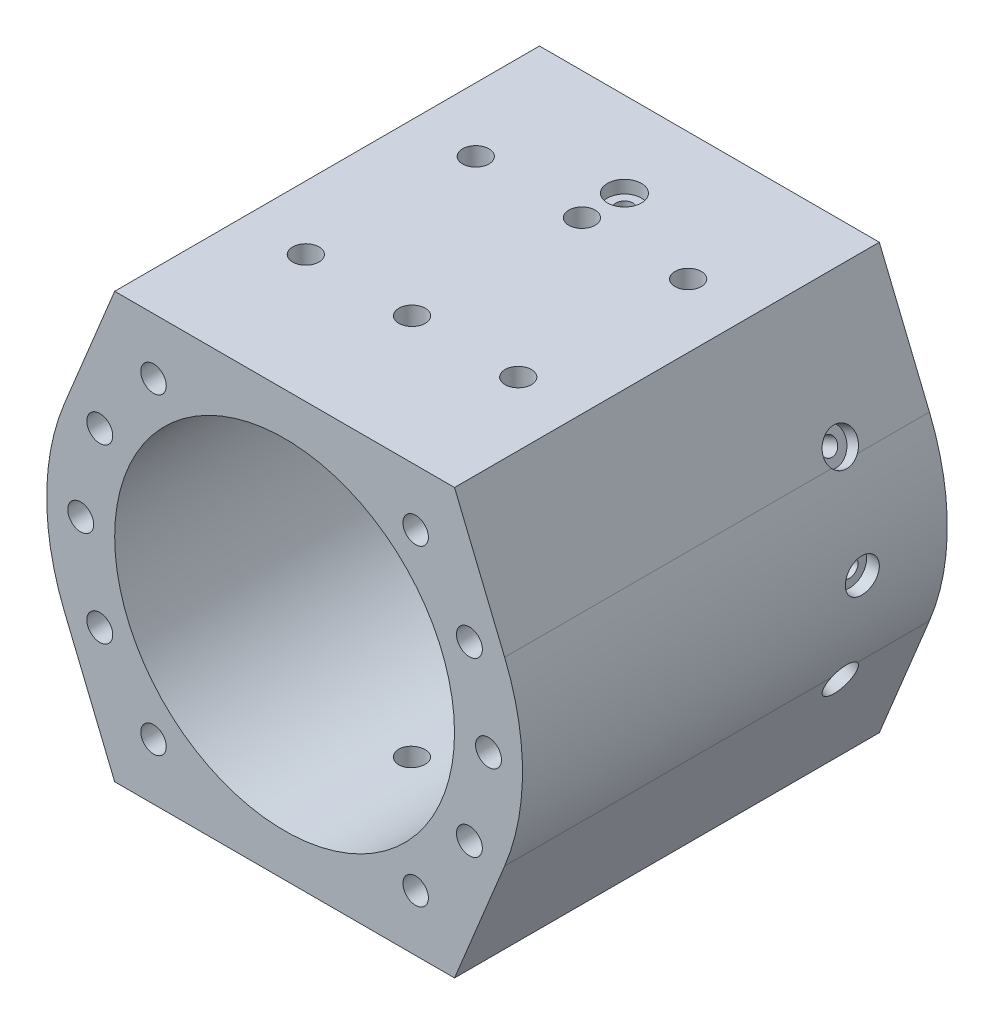
from build123d import *

# Parameters (mm, degrees)
SKETCH_1_R                       = 40
EXTRUDE_1_DEPTH                  = 100
SKETCH_2_R                       = 3.05
CUT_EXTRUDE_1_DEPTH              = 8
SKETCH_3_R                       = 3
CUT_EXTRUDE_2_DEPTH              = 100
CUT_EXTRUDE_3_REACH              = 160.253
SKETCH_4_R                       = 2
CUT_EXTRUDE_3_DIRECTION_2_DEPTH  = 3
SKETCH_5_R                       = 4
CUT_EXTRUDE_4_DEPTH              = 3
PATTERN_START                    = 39.94996861
PATTERN_CIRCULAR_1_OUTLINE_R     = 2
PATTERN_CIRCULAR_1_DEPTH         = 16.296886398
PATTERN_START_2                  = 53
PATTERN_CIRCULAR_1_2_OUTLINE_R   = 4
PATTERN_CIRCULAR_1_2_OUTLINE_R_2 = 2
PATTERN_CIRCULAR_1_2_DEPTH       = 3.246855008
PATTERN_CIRCULAR_1_3_OUTLINE_R   = 2
PATTERN_CIRCULAR_1_3_DEPTH       = 16.296886398
PATTERN_CIRCULAR_1_4_OUTLINE_R   = 4
PATTERN_CIRCULAR_1_4_OUTLINE_R_2 = 2
PATTERN_CIRCULAR_1_4_DEPTH       = 3.246855008
SKETCH_7_R                       = 2
CUT_EXTRUDE_5_DEPTH              = 153.105226841
SKETCH_8_R                       = 4
CUT_EXTRUDE_6_DEPTH              = 3
CUT_EXTRUDE_START                = -3
SKETCH_9_R                       = 4
CUT_EXTRUDE_7_DEPTH              = 3
SKETCH_10_R                      = 3.1
CUT_EXTRUDE_8_DEPTH              = 8
SKETCH_11_R                      = 3.1
CUT_EXTRUDE_9_DEPTH              = 100


# Read off the part's stored shape, not the designer's step: Круговой массив1
with BuildPart() as part:
    # Эскиз1 → Бобышка-Вытянуть1 (new body)
    with BuildSketch(Plane.XY):
        with BuildLine():
            Line((40, 50), (-40, 50))
            Line((-40, 50), (-51.798872756, 21.280901795))
            ThreePointArc((-51.798872756, 21.280901795), (-56, 0), (-51.798872756, -21.280901795))
            Line((-51.798872756, -21.280901795), (-40, -50))
            Line((-40, -50), (40, -50))
            Line((40, -50), (51.798872756, -21.280901795))
            ThreePointArc((51.798872756, -21.280901795), (56, 0), (51.798872756, 21.280901795))
            Line((51.798872756, 21.280901795), (40, 50))
        make_face()
        Circle(SKETCH_1_R, mode=Mode.SUBTRACT)
    extrude(amount=EXTRUDE_1_DEPTH)

    # Эскиз2 → Вырез-Вытянуть1 (cut)
    with BuildSketch(Plane.XY.offset(100)):
        with Locations((-48, 0)):
            Circle(SKETCH_2_R)
        with Locations((-43.502773778, 20.285676564)):
            Circle(SKETCH_2_R)
        with Locations((-43.502773778, -20.285676564)):
            Circle(SKETCH_2_R)
        with Locations(Location((43.502773778, -20.285676564, 0), (0, 0, 180))):
            Circle(SKETCH_2_R)
        with Locations(Location((43.502773778, 20.285676564, 0), (0, 0, 180))):
            Circle(SKETCH_2_R)
        with Locations(Location((48, 0, 0), (0, 0, 180))):
            Circle(SKETCH_2_R)
    cut_extrude_1 = extrude(amount=-CUT_EXTRUDE_1_DEPTH, mode=Mode.SUBTRACT)

    # Зеркальное отражение1: Вырез-Вытянуть1 across plane
    add(cut_extrude_1.mirror(Plane.XY.offset(50)), mode=Mode.SUBTRACT)

    # Эскиз3 → Вырез-Вытянуть2 (cut)
    with BuildSketch(Plane.XY.offset(100)):
        with Locations((-30.853805265, 36.77013327)):
            Circle(SKETCH_3_R)
        with Locations((-30.853805265, -36.77013327)):
            Circle(SKETCH_3_R)
        with Locations((30.853805265, -36.77013327)):
            Circle(SKETCH_3_R)
        with Locations((30.853805265, 36.77013327)):
            Circle(SKETCH_3_R)
    extrude(amount=-CUT_EXTRUDE_2_DEPTH, mode=Mode.SUBTRACT)

    # Эскиз4 → Вырез-Вытянуть3 (cut, up to next)
    with BuildSketch(Plane(origin=(56, 0, 0), x_dir=(0, 0, -1), z_dir=(1, 0, 0)), mode=Mode.PRIVATE) as cut_extrude_3_sk1:
        with Locations(Location((-20, 0, 0), (0, 0, 180))):
            Circle(SKETCH_4_R)
    cut_extrude_3_tool1 = extrude(cut_extrude_3_sk1.sketch, amount=-CUT_EXTRUDE_3_REACH, mode=Mode.PRIVATE) & part.part
    cut_extrude_3 = cut_extrude_3_tool1.solids().sort_by_distance((56, 0, 20))[0]
    add(cut_extrude_3, mode=Mode.SUBTRACT)

    # Эскиз4 → Вырез-Вытянуть3 direction 2 (cut)
    with BuildSketch(Plane(origin=(56, 0, 0), x_dir=(0, 0, -1), z_dir=(1, 0, 0))):
        with Locations(Location((-20, 0, 0), (0, 0, 180))):
            Circle(SKETCH_4_R)
    cut_extrude_3_direction_2 = extrude(amount=CUT_EXTRUDE_3_DIRECTION_2_DEPTH, mode=Mode.SUBTRACT)

    # Эскиз5 → Вырез-Вытянуть4 (cut, symmetric)
    with BuildSketch(Plane(origin=(56, 0, 0), x_dir=(0, 0, -1), z_dir=(1, 0, 0))):
        with Locations(Location((-20, 0, 0), (0, 0, 180))):
            Circle(SKETCH_5_R)
    cut_extrude_4 = extrude(amount=CUT_EXTRUDE_4_DEPTH, both=True, mode=Mode.SUBTRACT)

    # Круговой массив1 outline → Круговой массив1 (cut)
    with BuildSketch(Plane(origin=(0, 0, 0), x_dir=(-0.4226182617407003, 0.9063077870366495, 0), z_dir=(0.9063077870366496, 0.4226182617407003, 0)).offset(PATTERN_START)):
        with Locations((0, 20)):
            Circle(PATTERN_CIRCULAR_1_OUTLINE_R)
    pattern_circular_1 = extrude(amount=PATTERN_CIRCULAR_1_DEPTH, mode=Mode.SUBTRACT)

    # Pattern Circular 1 2 outline → Pattern Circular 1 2 (cut)
    with BuildSketch(Plane(origin=(0, 0, 0), x_dir=(-0.4226182617407003, 0.9063077870366495, 0), z_dir=(0.9063077870366496, 0.4226182617407003, 0)).offset(PATTERN_START_2)):
        with Locations((0, 20)):
            Circle(PATTERN_CIRCULAR_1_2_OUTLINE_R)
        with Locations((0, 20)):
            Circle(PATTERN_CIRCULAR_1_2_OUTLINE_R_2, mode=Mode.SUBTRACT)
    pattern_circular_1_2 = extrude(amount=PATTERN_CIRCULAR_1_2_DEPTH, mode=Mode.SUBTRACT)

    # Pattern Circular 1 3 outline → Pattern Circular 1 3 (cut)
    with BuildSketch(Plane(origin=(0, 0, 0), x_dir=(0.4226182617407003, 0.9063077870366495, 0), z_dir=(0.9063077870366496, -0.4226182617407003, 0)).offset(PATTERN_START)):
        with Locations((0, 20)):
            Circle(PATTERN_CIRCULAR_1_3_OUTLINE_R)
    pattern_circular_1_3 = extrude(amount=PATTERN_CIRCULAR_1_3_DEPTH, mode=Mode.SUBTRACT)

    # Pattern Circular 1 4 outline → Pattern Circular 1 4 (cut)
    with BuildSketch(Plane(origin=(0, 0, 0), x_dir=(0.4226182617407003, 0.9063077870366495, 0), z_dir=(0.9063077870366496, -0.4226182617407003, 0)).offset(PATTERN_START_2)):
        with Locations((0, 20)):
            Circle(PATTERN_CIRCULAR_1_4_OUTLINE_R)
        with Locations((0, 20)):
            Circle(PATTERN_CIRCULAR_1_4_OUTLINE_R_2, mode=Mode.SUBTRACT)
    pattern_circular_1_4 = extrude(amount=PATTERN_CIRCULAR_1_4_DEPTH, mode=Mode.SUBTRACT)

    # Зеркальное отражение2: Вырез-Вытянуть3, Вырез-Вытянуть3 direction 2, Вырез-Вытянуть4, Круговой массив1, Pattern Circular 1 2, Pattern Circular 1 3, Pattern Circular 1 4 across plane
    add(cut_extrude_3.mirror(Plane.ZY), mode=Mode.SUBTRACT)
    add(cut_extrude_3_direction_2.mirror(Plane.ZY), mode=Mode.SUBTRACT)
    add(cut_extrude_4.mirror(Plane.ZY), mode=Mode.SUBTRACT)
    add(pattern_circular_1.mirror(Plane.ZY), mode=Mode.SUBTRACT)
    add(pattern_circular_1_2.mirror(Plane.ZY), mode=Mode.SUBTRACT)
    add(pattern_circular_1_3.mirror(Plane.ZY), mode=Mode.SUBTRACT)
    add(pattern_circular_1_4.mirror(Plane.ZY), mode=Mode.SUBTRACT)

    # Эскиз7 → Вырез-Вытянуть5 (cut, through all)
    with BuildSketch(Plane(origin=(0, 50, 0), x_dir=(1, 0, 0), z_dir=(0, 1, 0))):
        with Locations(Location((0, -20, 0), (0, 0, 180))):
            Circle(SKETCH_7_R)
    extrude(amount=-CUT_EXTRUDE_5_DEPTH, mode=Mode.SUBTRACT)

    # Эскиз8 → Вырез-Вытянуть6 (cut)
    with BuildSketch(Plane(origin=(0, 50, 0), x_dir=(1, 0, 0), z_dir=(0, 1, 0))):
        with Locations(Location((0, -20, 0), (0, 0, 180))):
            Circle(SKETCH_8_R)
    extrude(amount=-CUT_EXTRUDE_6_DEPTH, mode=Mode.SUBTRACT)

    # Эскиз9 → Вырез-Вытянуть7 (cut)
    with BuildSketch(Plane.XZ.offset(50).offset(CUT_EXTRUDE_START)):
        with Locations(Location((0, 20, 0), (0, 0, 180))):
            Circle(SKETCH_9_R)
    extrude(amount=CUT_EXTRUDE_7_DEPTH, mode=Mode.SUBTRACT)

    # Эскиз10 → Вырез-Вытянуть8 (cut)
    with BuildSketch(Plane(origin=(0, 50, 0), x_dir=(1, 0, 0), z_dir=(0, 1, 0))):
        with Locations(Location((-25, -30, 0), (0, 0, 180))):
            Circle(SKETCH_10_R)
        with Locations(Location((0, -30, 0), (0, 0, 180))):
            Circle(SKETCH_10_R)
        with Locations(Location((25, -30, 0), (0, 0, 180))):
            Circle(SKETCH_10_R)
        with Locations((25, -70)):
            Circle(SKETCH_10_R)
        with Locations((0, -70)):
            Circle(SKETCH_10_R)
        with Locations((-25, -70)):
            Circle(SKETCH_10_R)
    cut_extrude_8 = extrude(amount=-CUT_EXTRUDE_8_DEPTH, mode=Mode.SUBTRACT)

    # Зеркальное отражение3: Вырез-Вытянуть8 across plane
    add(cut_extrude_8.mirror(Plane.ZX), mode=Mode.SUBTRACT)

    # Эскиз11 → Вырез-Вытянуть9 (cut)
    with BuildSketch(Plane(origin=(0, 50, 0), x_dir=(1, 0, 0), z_dir=(0, 1, 0))):
        with Locations(Location((0, -30, 0), (0, 0, 180))):
            Circle(SKETCH_11_R)
        with Locations(Location((0, -70, 0), (0, 0, 180))):
            Circle(SKETCH_11_R)
    extrude(amount=-CUT_EXTRUDE_9_DEPTH, mode=Mode.SUBTRACT)


solid = part.part
